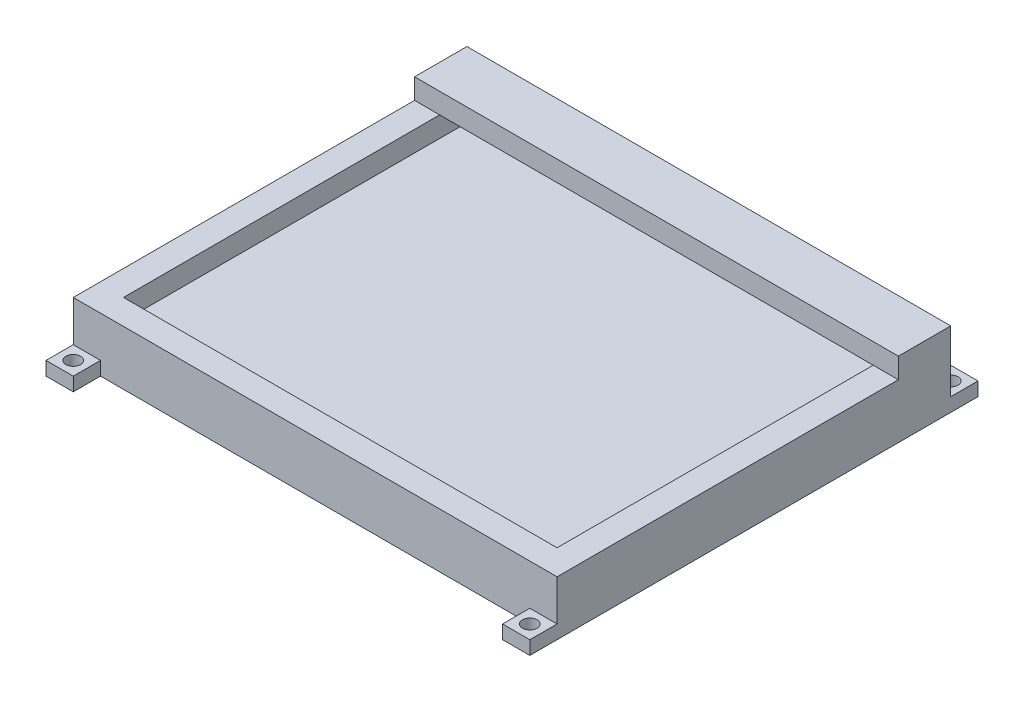
from build123d import *

# Parameters (mm, degrees)
SKETCH1_W           = 112.699999898
SKETCH1_H           = 91.699999988
BOSS_EXTRUDE1_DEPTH = 12.7
SKETCH2_W           = 100.999999898
SKETCH2_H           = 79.999999988
CUT_EXTRUDE1_DEPTH  = 4.7625
SKETCH3_W           = 6.35
SKETCH3_H           = 6.35
SKETCH3_R           = 1.7
BOSS_EXTRUDE2_DEPTH = 3.175
SKETCH4_W           = 112.699999898
SKETCH4_H           = 12.199999984
BOSS_EXTRUDE3_DEPTH = 4.7625


with BuildPart() as part:
    # Sketch1 → Boss-Extrude1 (new body)
    with BuildSketch(Plane(origin=(0, 0, 0), x_dir=(1, 0, 0), z_dir=(0, 1, 0))):
        with Locations((56.349999949, 45.849999994)):
            Rectangle(SKETCH1_W, SKETCH1_H)
    extrude(amount=BOSS_EXTRUDE1_DEPTH)

    # Sketch2 → Cut-Extrude1 (cut)
    with BuildSketch(Plane(origin=(0, 12.7, 0), x_dir=(1, 0, 0), z_dir=(0, 1, 0))):
        with Locations((56.349999949, 45.849999994)):
            Rectangle(SKETCH2_W, SKETCH2_H)
    extrude(amount=-CUT_EXTRUDE1_DEPTH, mode=Mode.SUBTRACT)

    # Sketch3 → Boss-Extrude2 (add)
    # profile 1 of 4: a face of its own
    with BuildSketch(Plane.XZ):
        with Locations((109.524999898, 3.175)):
            Rectangle(SKETCH3_W, SKETCH3_H)
        with Locations((109.524999898, 3.175)):
            Circle(SKETCH3_R, mode=Mode.SUBTRACT)
    # profile 2 of 4: a face of its own
    with BuildSketch(Plane.XZ):
        with Locations((3.175, 3.175)):
            Rectangle(SKETCH3_W, SKETCH3_H)
        with Locations((3.175, 3.175)):
            Circle(SKETCH3_R, mode=Mode.SUBTRACT)
    # profile 3 of 4: a face of its own
    with BuildSketch(Plane.XZ):
        with Locations((3.175, -94.874999988)):
            Rectangle(SKETCH3_W, SKETCH3_H)
        with Locations((3.175, -94.874999988)):
            Circle(SKETCH3_R, mode=Mode.SUBTRACT)
    # profile 4 of 4: a face of its own
    with BuildSketch(Plane.XZ):
        with Locations((109.524999898, -94.874999988)):
            Rectangle(SKETCH3_W, SKETCH3_H)
        with Locations((109.524999898, -94.874999988)):
            Circle(SKETCH3_R, mode=Mode.SUBTRACT)
    extrude(amount=-BOSS_EXTRUDE2_DEPTH)

    # Sketch4 → Boss-Extrude3 (add)
    with BuildSketch(Plane(origin=(0, 12.7, 0), x_dir=(1, 0, 0), z_dir=(0, 1, 0))):
        with Locations((56.349999949, 85.599999996)):
            Rectangle(SKETCH4_W, SKETCH4_H)
    extrude(amount=BOSS_EXTRUDE3_DEPTH)


solid = part.part
